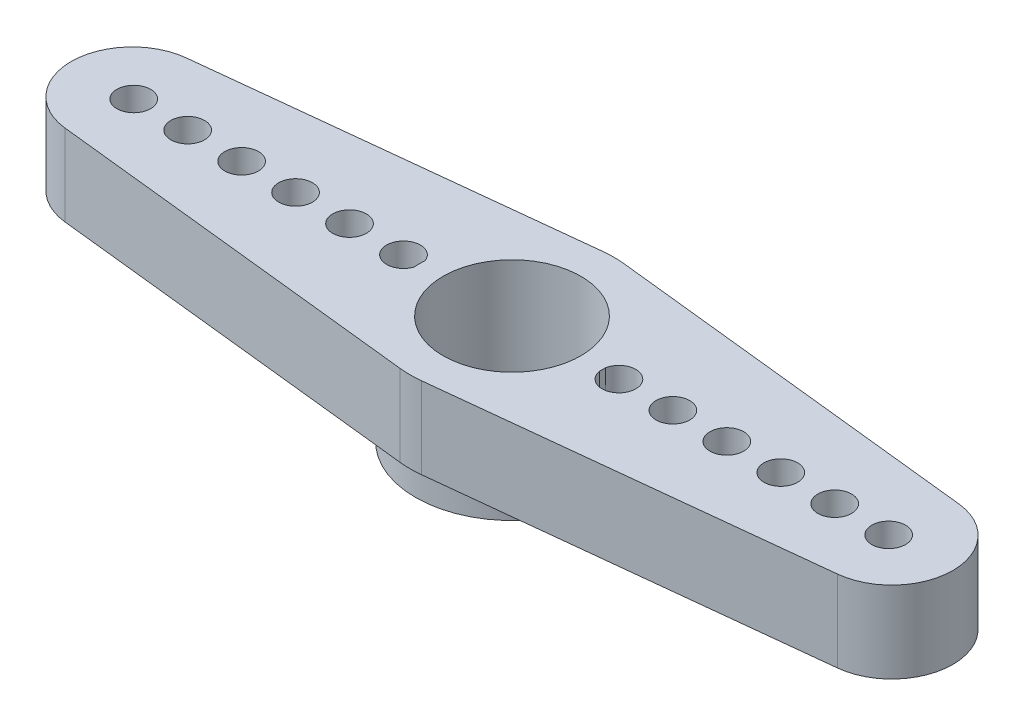
from build123d import *

# Parameters (mm, degrees)
BOSS_EXTRUDE1_DEPTH     = 2.999994
SKETCH3_R               = 3.375082345
SKETCH3_R_2             = 2.3700486
BOSS_EXTRUDE2_DEPTH     = 3.302
SKETCH4_R               = 2.3700486
SKETCH4_R_2             = 1.524
BOSS_EXTRUDE3_DEPTH     = 2.237994
SKETCH5_R               = 3.556
SKETCH5_R_2             = 1.524049463
BOSS_EXTRUDE4_DEPTH     = 1.016
SKETCH6_R               = 1.524049463
CUT_EXTRUDE2_DEPTH      = 20.69939547
CUT_EXTRUDE3_START      = -4.015994
CUT_EXTRUDE3_OUTLINE_R  = 0.621776252
CUT_EXTRUDE3_DEPTH      = 4.015994
CUT_EXTRUDE4_DEPTH      = 21.047545727
CUT_EXTRUDE4_DEPTH_BACK = 3.302
SKETCH9_R               = 3.375082345
SKETCH10_R              = 2.54
CUT_EXTRUDE5_DEPTH      = 20.091339956


# Read off the part's stored shape, not the designer's step: Cut-Extrude3
with BuildPart() as part:
    # Sketch1 → Boss-Extrude1 (new body)
    with BuildSketch(Plane(origin=(0, 0, 0), x_dir=(1, 0, 0), z_dir=(0, 1, 0))):
        with BuildLine():
            Line((-14.960824333, 6.251943389), (-1.121532733, 7.748689189))
            ThreePointArc((-1.121532733, 7.748689189), (-0.719755533, 7.770352511), (-0.317978333, 7.748689189))
            Line((-0.317978333, 7.748689189), (13.521313267, 6.251943389))
            ThreePointArc((13.521313267, 6.251943389), (15.530246603, 4.014889189), (13.521313267, 1.777834989))
            Line((13.521313267, 1.777834989), (-0.317978333, 0.281089189))
            ThreePointArc((-0.317978333, 0.281089189), (-0.719755533, 0.259425867), (-1.121532733, 0.281089189))
            Line((-1.121532733, 0.281089189), (-14.960824333, 1.777834989))
            ThreePointArc((-14.960824333, 1.777834989), (-16.96975767, 4.014889189), (-14.960824333, 6.251943389))
        make_face()
    extrude(amount=BOSS_EXTRUDE1_DEPTH)

    # Sketch3 → Boss-Extrude2 (add)
    with BuildSketch(Plane(origin=(0, 2.999994, 0), x_dir=(1, 0, 0), z_dir=(0, 1, 0))):
        with Locations(Location((-0.719755307, 4.013536412, 0), (0, 0, 90))):
            Circle(SKETCH3_R)
        with Locations(Location((-0.719755307, 4.013536412, 0), (0, 0, 90))):
            Circle(SKETCH3_R_2, mode=Mode.SUBTRACT)
    extrude(amount=BOSS_EXTRUDE2_DEPTH)

    # Sketch4 → Boss-Extrude3 (add)
    with BuildSketch(Plane.XZ):
        with Locations(Location((-0.719755307, -4.013536412, 0), (0, 0, 270))):
            Circle(SKETCH4_R)
        with Locations((-0.719755307, -4.013536412)):
            Circle(SKETCH4_R_2, mode=Mode.SUBTRACT)
    extrude(amount=-BOSS_EXTRUDE3_DEPTH)

    # Sketch5 → Boss-Extrude4 (add)
    with BuildSketch(Plane.XZ):
        with Locations(Location((-0.7197993, -4.014912249, 0), (0, 0, 270))):
            Circle(SKETCH5_R)
        with Locations(Location((-0.7197993, -4.014912249, 0), (0, 0, 270))):
            Circle(SKETCH5_R_2, mode=Mode.SUBTRACT)
    extrude(amount=BOSS_EXTRUDE4_DEPTH)

    # Sketch6 → Cut-Extrude2 (cut, through all)
    with BuildSketch(Plane.XZ):
        with Locations(Location((-0.7197993, -4.014912249, 0), (0, 0, 270))):
            Circle(SKETCH6_R)
    extrude(amount=-CUT_EXTRUDE2_DEPTH, mode=Mode.SUBTRACT)

    # Cut-Extrude3 outline → Cut-Extrude3 (cut)
    with BuildSketch(Plane(origin=(0, 2.999994, 0), x_dir=(1, 0, 0), z_dir=(0, 1, 0)).offset(CUT_EXTRUDE3_START)):
        with BuildLine():
            ThreePointArc((-4.086322125, 3.773935294), (-4.094643941, 3.977376451), (-4.090683041, 4.18094921))
            ThreePointArc((-4.090683041, 4.18094921), (-5.297734637, 3.964486038), (-4.086322125, 3.773935294))
        make_face()
        with BuildLine():
            ThreePointArc((2.654580903, 4.084501036), (2.655136179, 3.977643639), (2.652308378, 3.870822222))
            ThreePointArc((2.652308378, 3.870822222), (3.887678446, 3.964535259), (2.654580903, 4.084501036))
        make_face()
        with Locations((-6.664608508, 3.970614789)):
            Circle(CUT_EXTRUDE3_OUTLINE_R)
        with Locations((9.231780819, 3.970614789)):
            Circle(CUT_EXTRUDE3_OUTLINE_R)
        with Locations((11.220395333, 3.970614789)):
            Circle(CUT_EXTRUDE3_OUTLINE_R)
        with Locations((13.209009847, 3.970614789)):
            Circle(CUT_EXTRUDE3_OUTLINE_R)
        with Locations((7.243166305, 3.970614789)):
            Circle(CUT_EXTRUDE3_OUTLINE_R)
        with Locations((5.254551791, 3.970614789)):
            Circle(CUT_EXTRUDE3_OUTLINE_R)
        with Locations((-14.619066564, 3.970614789)):
            Circle(CUT_EXTRUDE3_OUTLINE_R)
        with Locations((-12.63045205, 3.970614789)):
            Circle(CUT_EXTRUDE3_OUTLINE_R)
        with Locations((-10.641837536, 3.970614789)):
            Circle(CUT_EXTRUDE3_OUTLINE_R)
        with Locations((-8.653223022, 3.970614789)):
            Circle(CUT_EXTRUDE3_OUTLINE_R)
    extrude(amount=CUT_EXTRUDE3_DEPTH, mode=Mode.SUBTRACT)

    # Sketch9 → Cut-Extrude4 (cut, two sides: drawn at the far end of the back side and taken through both)
    with BuildSketch(Plane(origin=(0, 6.301994, 0), x_dir=(1, 0, 0), z_dir=(0, 1, 0)).offset(-CUT_EXTRUDE4_DEPTH_BACK)):
        with Locations((-0.719755307, 4.013536412)):
            Circle(SKETCH9_R)
    extrude(amount=CUT_EXTRUDE4_DEPTH + CUT_EXTRUDE4_DEPTH_BACK, mode=Mode.SUBTRACT)

    # Sketch10 → Cut-Extrude5 (cut, through all)
    with BuildSketch(Plane(origin=(0, 2.999994, 0), x_dir=(1, 0, 0), z_dir=(0, 1, 0))):
        with Locations(Location((-0.7197993, 4.014912249, 0), (0, 0, 270))):
            Circle(SKETCH10_R)
    extrude(amount=-CUT_EXTRUDE5_DEPTH, mode=Mode.SUBTRACT)


solid = part.part
